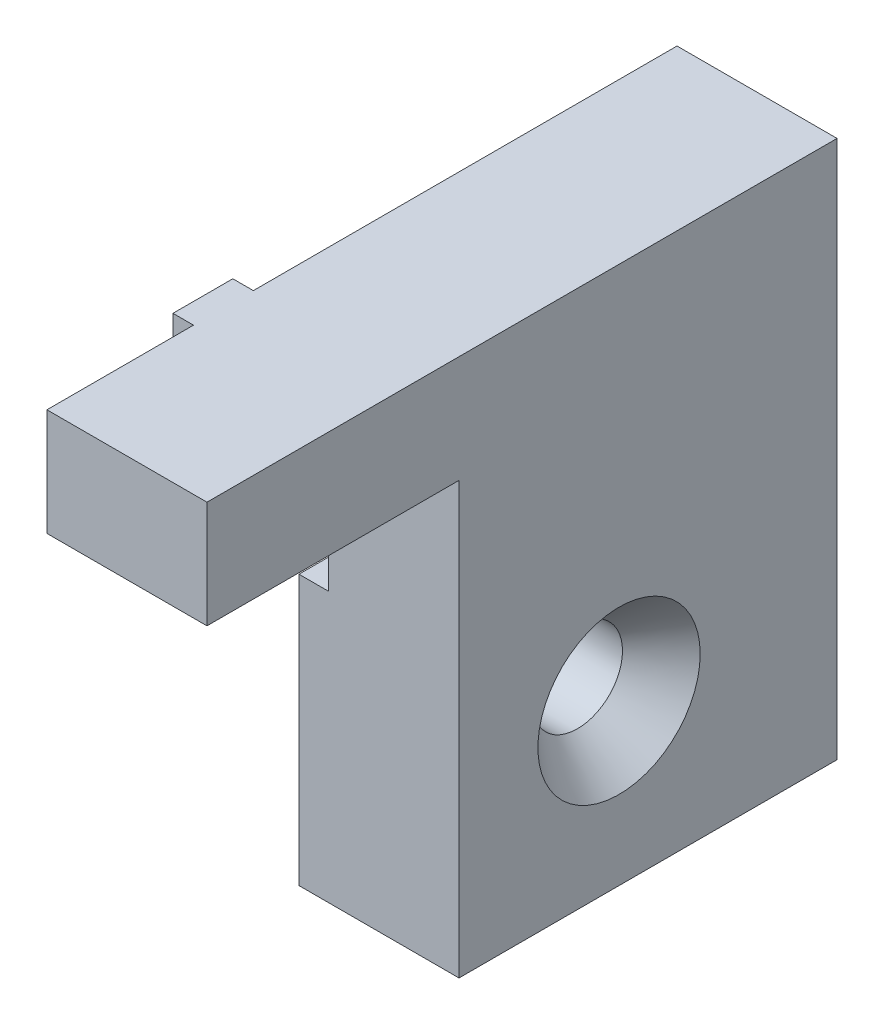
from build123d import *

# Parameters (mm, degrees)
SKETCH1_R                                        = 3.175
BOSS_EXTRUDE1_DEPTH                              = 12.7
CSK_FOR_1_4_FLAT_HEAD_MACHINE_SCREW1_D           = 7.14248
CSK_FOR_1_4_FLAT_HEAD_MACHINE_SCREW1_CSINK_D     = 12.8778
CSK_FOR_1_4_FLAT_HEAD_MACHINE_SCREW1_CSINK_ANGLE = 82
SKETCH3_W                                        = 8
SKETCH3_H                                        = 12.8
CUT_EXTRUDE1_DEPTH                               = 2.35
SKETCH4_W                                        = 4.75
SKETCH4_H                                        = 8.5
BOSS_EXTRUDE2_DEPTH                              = 1.63


with BuildPart() as part:
    # Sketch1 → Boss-Extrude1 (new body)
    with BuildSketch(Plane(origin=(0, 0, 0), x_dir=(0, 0, -1), z_dir=(1, 0, 0))):
        Polygon((0, -34.2), (30, -34.2), (30, 8.5), (-20, 8.5), (-20, 0), (0, 0), align=None)
        with Locations((12.7, -21.5)):
            Circle(SKETCH1_R, mode=Mode.SUBTRACT)
    extrude(amount=BOSS_EXTRUDE1_DEPTH)

    # CSK for 1/4 Flat Head Machine Screw1 (through all)
    with Locations(Plane(origin=(12.7, -21.5, -12.7), x_dir=(0, 0, 1), z_dir=(1, 0, 0))):
        with Locations((0, 0)):
            CounterSinkHole(CSK_FOR_1_4_FLAT_HEAD_MACHINE_SCREW1_D / 2, CSK_FOR_1_4_FLAT_HEAD_MACHINE_SCREW1_CSINK_D / 2, counter_sink_angle=CSK_FOR_1_4_FLAT_HEAD_MACHINE_SCREW1_CSINK_ANGLE)

    # Sketch3 → Cut-Extrude1 (cut)
    with BuildSketch(Plane.ZY):
        with Locations((-4, -6.4)):
            Rectangle(SKETCH3_W, SKETCH3_H)
    extrude(amount=-CUT_EXTRUDE1_DEPTH, mode=Mode.SUBTRACT)

    # Sketch4 → Boss-Extrude2 (add)
    with BuildSketch(Plane.ZY):
        with Locations((5.995, 4.25)):
            Rectangle(SKETCH4_W, SKETCH4_H)
    extrude(amount=BOSS_EXTRUDE2_DEPTH)


solid = part.part
